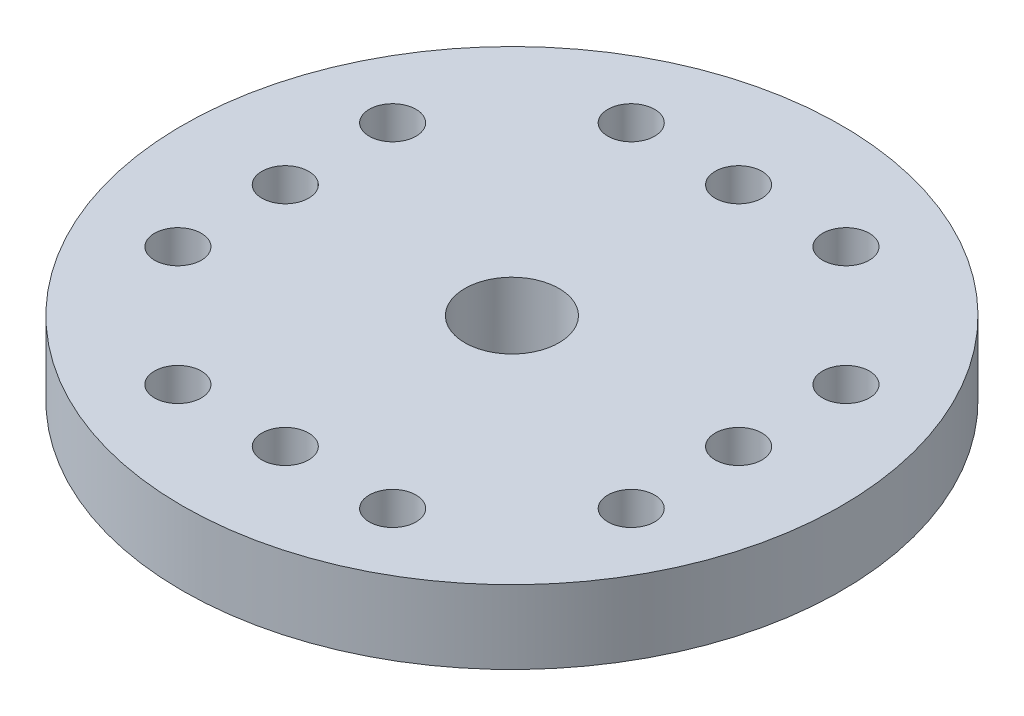
from build123d import *

# Parameters (mm, degrees)
SKETCH1_R               = 10.36
BOSS_EXTRUDE1_DEPTH     = 2.31
BOSS_EXTRUDE2_START     = -2.31
SKETCH2_R               = 4.375
BOSS_EXTRUDE2_DEPTH     = 5.49
CUT_EXTRUDE1_DEPTH      = 16.646063403
CUT_EXTRUDE1_DEPTH_BACK = 16.646063403
SKETCH5_R               = 1.48
SKETCH6_R               = 2.79
CUT_EXTRUDE2_DEPTH      = 2.75
SKETCH7_R               = 0.735
CUT_EXTRUDE3_DEPTH      = 15.992384734
CRVPATTERN2_OUTLINE_R   = 0.735
CRVPATTERN2_DEPTH       = 2.31
CIRPATTERN1_COUNT       = 4


# Read off the part's stored shape, not the designer's step: CrvPattern2
with BuildPart() as part:
    # Sketch1 → Boss-Extrude1 (new body)
    with BuildSketch(Plane(origin=(0, 0, 0), x_dir=(1, 0, 0), z_dir=(0, 1, 0))):
        with Locations(Location((0, 0, 0), (0, 0, 270))):
            Circle(SKETCH1_R)
    extrude(amount=BOSS_EXTRUDE1_DEPTH)

    # Sketch2 → Boss-Extrude2 (add)
    with BuildSketch(Plane(origin=(0, 0, 0), x_dir=(-1, 0, 0), z_dir=(0, -1, 0)).offset(BOSS_EXTRUDE2_START)):
        with Locations(Location((0, 0, 0), (0, 0, 270))):
            Circle(SKETCH2_R)
    extrude(amount=BOSS_EXTRUDE2_DEPTH)

    # Sketch5 → Cut-Extrude1 (cut, two sides: drawn at the far end of the back side and taken through both)
    with BuildSketch(Plane(origin=(0, 2.31, 0), x_dir=(1, 0, 0), z_dir=(0, 1, 0)).offset(-CUT_EXTRUDE1_DEPTH_BACK)):
        with Locations(Location((0, 0, 0), (0, 0, 270))):
            Circle(SKETCH5_R)
    extrude(amount=CUT_EXTRUDE1_DEPTH + CUT_EXTRUDE1_DEPTH_BACK, mode=Mode.SUBTRACT)

    # Sketch6 → Cut-Extrude2 (cut)
    with BuildSketch(Plane.XZ.offset(3.18)):
        with Locations(Location((0, 0, 0), (0, 0, 270))):
            Circle(SKETCH6_R)
    extrude(amount=-CUT_EXTRUDE2_DEPTH, mode=Mode.SUBTRACT)

    # Sketch7 → Cut-Extrude3 (cut, symmetric)
    with BuildSketch(Plane(origin=(0, 0, 0), x_dir=(1, 0, 0), z_dir=(0, 1, 0))):
        with Locations(Location((-3.375, 7.125, 0), (0, 0, 270))):
            Circle(SKETCH7_R)
    cut_extrude3 = extrude(amount=CUT_EXTRUDE3_DEPTH, both=True, mode=Mode.SUBTRACT)

    # CrvPattern2 outline → CrvPattern2 (cut)
    with BuildSketch(Plane(origin=(0, 0, 0), x_dir=(1, 0, 0), z_dir=(0, 1, 0))):
        with Locations((3.375, 7.125)):
            Circle(CRVPATTERN2_OUTLINE_R)
        with Locations((0, 7.125)):
            Circle(CRVPATTERN2_OUTLINE_R)
    crvpattern2 = extrude(amount=CRVPATTERN2_DEPTH, mode=Mode.SUBTRACT)

    # CirPattern1: Cut-Extrude3, CrvPattern2 ×4 about axis
    cirpattern1_axis = Axis((0, 0, 0), (0, 1, 0))
    add([cut_extrude3.rotate(cirpattern1_axis, i * 360 / CIRPATTERN1_COUNT) for i in range(1, CIRPATTERN1_COUNT)], mode=Mode.SUBTRACT)
    add([crvpattern2.rotate(cirpattern1_axis, i * 360 / CIRPATTERN1_COUNT) for i in range(1, CIRPATTERN1_COUNT)], mode=Mode.SUBTRACT)


solid = part.part
